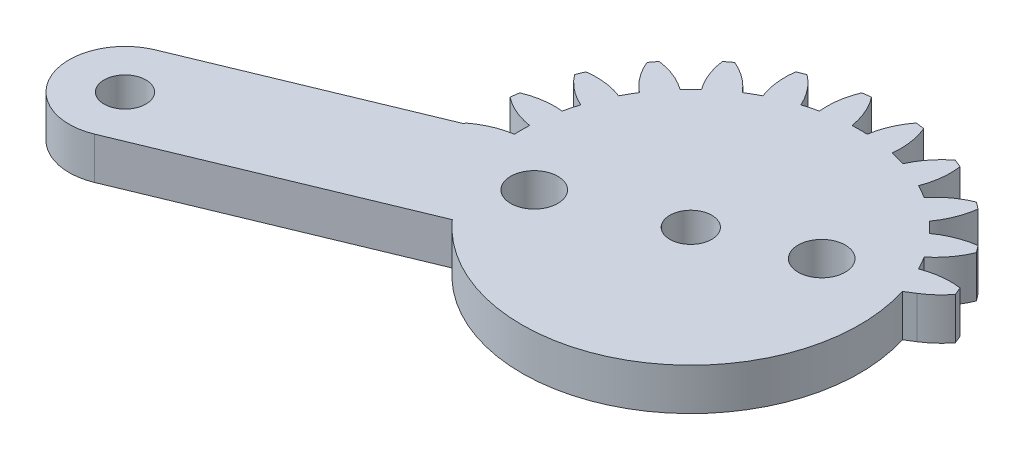
from build123d import *

# Parameters (mm, degrees)
SKETCH1_R              = 1.5
BOSS_EXTRUDE1_DEPTH    = 3
SKETCH3_R              = 1.5
BOSS_EXTRUDE2_DEPTH    = 3
CUT_EXTRUDE1_OUTLINE_R = 1.5
CUT_EXTRUDE1_DEPTH     = 3
SCALE1_SCALE           = 0.888888889
BOSS_EXTRUDE3_START    = -2.666666667
SKETCH5_R              = 1.333333333
BOSS_EXTRUDE3_DEPTH    = 2.666666667
SKETCH6_R              = 1.5
CUT_EXTRUDE2_DEPTH     = 10


# Read off the part's stored shape, not the designer's step: Cut-Extrude1
with BuildPart() as part:
    # Sketch1 → Boss-Extrude1 (new body)
    with BuildSketch(Plane(origin=(0, 0, 0), x_dir=(1, 0, 0), z_dir=(0, 1, 0))):
        with BuildLine():
            Line((20.643657446, 4), (2.081641936, 4))
            ThreePointArc((2.081641936, 4), (2.861028333, 4.588201733), (3.521749436, 5.30713988))
            ThreePointArc((3.521749436, 5.30713988), (3.405395609, 5.596745198), (3.282888305, 5.883801663))
            ThreePointArc((3.282888305, 5.883801663), (1.93527598, 5.894040025), (0.627094961, 5.57027124))
            ThreePointArc((0.627094961, 5.57027124), (0.366286148, 6.046375), (0.084372603, 6.510293938))
            ThreePointArc((0.084372603, 6.510293938), (1.018855105, 7.48132754), (1.683794586, 8.65351323))
            ThreePointArc((1.683794586, 8.65351323), (1.496450048, 8.903135899), (1.303821399, 9.148703928))
            ThreePointArc((1.303821399, 9.148703928), (-0.000522033, 8.809805691), (-1.180330337, 8.158486898))
            ThreePointArc((-1.180330337, 8.158486898), (-1.555477026, 8.550865528), (-1.947855656, 8.926012217))
            ThreePointArc((-1.947855656, 8.926012217), (-1.296536862, 10.105820521), (-0.957638625, 11.410163953))
            ThreePointArc((-0.957638625, 11.410163953), (-1.203206655, 11.602792602), (-1.452829324, 11.79013714))
            ThreePointArc((-1.452829324, 11.79013714), (-2.625015014, 11.125197659), (-3.596048616, 10.190715157))
            ThreePointArc((-3.596048616, 10.190715157), (-4.059967554, 10.472628702), (-4.536071314, 10.733437515))
            ThreePointArc((-4.536071314, 10.733437515), (-4.212302529, 12.041618533), (-4.222540891, 13.389230859))
            ThreePointArc((-4.222540891, 13.389230859), (-4.509597355, 13.511738163), (-4.799202674, 13.62809199))
            ThreePointArc((-4.799202674, 13.62809199), (-5.759348103, 12.682425791), (-6.455432668, 11.528463019))
            ThreePointArc((-6.455432668, 11.528463019), (-6.976508546, 11.680699536), (-7.503891752, 11.809396783))
            ThreePointArc((-7.503891752, 11.809396783), (-7.529737283, 13.156800143), (-7.888414517, 14.455843809))
            ThreePointArc((-7.888414517, 14.455843809), (-8.197396993, 14.499881098), (-8.507248835, 14.537314892))
            ThreePointArc((-8.507248835, 14.537314892), (-9.18992168, 13.375367565), (-9.563620196, 12.080565177))
            ThreePointArc((-9.563620196, 12.080565177), (-10.106342554, 12.09275), (-10.649064912, 12.080565177))
            ThreePointArc((-10.649064912, 12.080565177), (-11.022763428, 13.375367565), (-11.705436272, 14.537314892))
            ThreePointArc((-11.705436272, 14.537314892), (-12.015288115, 14.499881098), (-12.324270591, 14.455843809))
            ThreePointArc((-12.324270591, 14.455843809), (-12.682947825, 13.156800143), (-12.708793355, 11.809396783))
            ThreePointArc((-12.708793355, 11.809396783), (-13.236176561, 11.680699536), (-13.757252439, 11.528463019))
            ThreePointArc((-13.757252439, 11.528463019), (-14.453337005, 12.682425791), (-15.413482434, 13.62809199))
            ThreePointArc((-15.413482434, 13.62809199), (-15.703087752, 13.511738163), (-15.990144217, 13.389230859))
            ThreePointArc((-15.990144217, 13.389230859), (-16.000382579, 12.041618533), (-15.676613793, 10.733437515))
            ThreePointArc((-15.676613793, 10.733437515), (-16.152717554, 10.472628702), (-16.616636492, 10.190715157))
            ThreePointArc((-16.616636492, 10.190715157), (-17.587670094, 11.125197659), (-18.759855783, 11.79013714))
            ThreePointArc((-18.759855783, 11.79013714), (-19.009478453, 11.602792602), (-19.255046482, 11.410163953))
            ThreePointArc((-19.255046482, 11.410163953), (-18.916148245, 10.105820521), (-18.264829452, 8.926012217))
            ThreePointArc((-18.264829452, 8.926012217), (-18.657208082, 8.550865528), (-19.032354771, 8.158486898))
            ThreePointArc((-19.032354771, 8.158486898), (-20.212163074, 8.809805691), (-21.516506507, 9.148703928))
            ThreePointArc((-21.516506507, 9.148703928), (-21.709135156, 8.903135899), (-21.896479694, 8.65351323))
            ThreePointArc((-21.896479694, 8.65351323), (-21.231540213, 7.48132754), (-20.297057711, 6.510293938))
            ThreePointArc((-20.297057711, 6.510293938), (-20.578971255, 6.046375), (-20.839780068, 5.57027124))
            ThreePointArc((-20.839780068, 5.57027124), (-22.147961087, 5.894040025), (-23.495573413, 5.883801663))
            ThreePointArc((-23.495573413, 5.883801663), (-23.618080717, 5.596745198), (-23.734434544, 5.30713988))
            ThreePointArc((-23.734434544, 5.30713988), (-22.788768345, 4.346994451), (-21.634805572, 3.650909885))
            ThreePointArc((-21.634805572, 3.650909885), (-21.78704209, 3.129834008), (-21.915739337, 2.602450802))
            ThreePointArc((-21.915739337, 2.602450802), (-23.263142697, 2.576605271), (-24.562186363, 2.217928037))
            ThreePointArc((-24.562186363, 2.217928037), (-24.606223651, 1.908945561), (-24.643657446, 1.599093719))
            ThreePointArc((-24.643657446, 1.599093719), (-23.481710119, 0.916420874), (-22.186907731, 0.542722358))
            ThreePointArc((-22.186907731, 0.542722358), (-22.199092554, 0), (-22.186907731, -0.542722358))
            ThreePointArc((-22.186907731, -0.542722358), (-23.481710119, -0.916420874), (-24.643657446, -1.599093719))
            ThreePointArc((-24.643657446, -1.599093719), (-24.606223651, -1.908945561), (-24.562186363, -2.217928037))
            ThreePointArc((-24.562186363, -2.217928037), (-23.263142697, -2.576605271), (-21.915739337, -2.602450802))
            ThreePointArc((-21.915739337, -2.602450802), (-21.78704209, -3.129834008), (-21.634805572, -3.650909885))
            ThreePointArc((-21.634805572, -3.650909885), (-22.788768345, -4.346994451), (-23.734434544, -5.30713988))
            ThreePointArc((-23.734434544, -5.30713988), (-23.618080717, -5.596745198), (-23.495573413, -5.883801663))
            ThreePointArc((-23.495573413, -5.883801663), (-22.147961087, -5.894040025), (-20.839780068, -5.57027124))
            ThreePointArc((-20.839780068, -5.57027124), (-20.578971255, -6.046375), (-20.297057711, -6.510293938))
            ThreePointArc((-20.297057711, -6.510293938), (-21.231540213, -7.48132754), (-21.896479694, -8.65351323))
            ThreePointArc((-21.896479694, -8.65351323), (-21.709135156, -8.903135899), (-21.516506507, -9.148703928))
            ThreePointArc((-21.516506507, -9.148703928), (-20.212163074, -8.809805691), (-19.032354771, -8.158486898))
            ThreePointArc((-19.032354771, -8.158486898), (-18.657208082, -8.550865528), (-18.264829452, -8.926012217))
            ThreePointArc((-18.264829452, -8.926012217), (-18.916148245, -10.105820521), (-19.255046482, -11.410163953))
            ThreePointArc((-19.255046482, -11.410163953), (-19.009478453, -11.602792602), (-18.759855783, -11.79013714))
            ThreePointArc((-18.759855783, -11.79013714), (-17.587670094, -11.125197659), (-16.616636492, -10.190715157))
            ThreePointArc((-16.616636492, -10.190715157), (-16.152717554, -10.472628702), (-15.676613793, -10.733437515))
            ThreePointArc((-15.676613793, -10.733437515), (-16.000382579, -12.041618533), (-15.990144217, -13.389230859))
            ThreePointArc((-15.990144217, -13.389230859), (-15.703087752, -13.511738163), (-15.413482434, -13.62809199))
            ThreePointArc((-15.413482434, -13.62809199), (-14.453337005, -12.682425791), (-13.757252439, -11.528463019))
            ThreePointArc((-13.757252439, -11.528463019), (-13.236176561, -11.680699536), (-12.708793355, -11.809396783))
            ThreePointArc((-12.708793355, -11.809396783), (-12.682947825, -13.156800143), (-12.324270591, -14.455843809))
            ThreePointArc((-12.324270591, -14.455843809), (-12.015288115, -14.499881098), (-11.705436272, -14.537314892))
            ThreePointArc((-11.705436272, -14.537314892), (-11.022763428, -13.375367565), (-10.649064912, -12.080565177))
            ThreePointArc((-10.649064912, -12.080565177), (-10.106342554, -12.09275), (-9.563620196, -12.080565177))
            ThreePointArc((-9.563620196, -12.080565177), (-9.18992168, -13.375367565), (-8.507248835, -14.537314892))
            ThreePointArc((-8.507248835, -14.537314892), (-8.197396993, -14.499881098), (-7.888414517, -14.455843809))
            ThreePointArc((-7.888414517, -14.455843809), (-7.529737283, -13.156800143), (-7.503891752, -11.809396783))
            ThreePointArc((-7.503891752, -11.809396783), (-6.976508546, -11.680699536), (-6.455432668, -11.528463019))
            ThreePointArc((-6.455432668, -11.528463019), (-5.759348103, -12.682425791), (-4.799202674, -13.62809199))
            ThreePointArc((-4.799202674, -13.62809199), (-4.509597355, -13.511738163), (-4.222540891, -13.389230859))
            ThreePointArc((-4.222540891, -13.389230859), (-4.212302529, -12.041618533), (-4.536071314, -10.733437515))
            ThreePointArc((-4.536071314, -10.733437515), (-4.059967554, -10.472628702), (-3.596048616, -10.190715157))
            ThreePointArc((-3.596048616, -10.190715157), (-2.625015014, -11.125197659), (-1.452829324, -11.79013714))
            ThreePointArc((-1.452829324, -11.79013714), (-1.203206655, -11.602792602), (-0.957638625, -11.410163953))
            ThreePointArc((-0.957638625, -11.410163953), (-1.296536862, -10.105820521), (-1.947855656, -8.926012217))
            ThreePointArc((-1.947855656, -8.926012217), (-1.555477026, -8.550865528), (-1.180330337, -8.158486898))
            ThreePointArc((-1.180330337, -8.158486898), (-0.000522033, -8.809805691), (1.303821399, -9.148703928))
            ThreePointArc((1.303821399, -9.148703928), (1.496450048, -8.903135899), (1.683794586, -8.65351323))
            ThreePointArc((1.683794586, -8.65351323), (1.018855105, -7.48132754), (0.084372603, -6.510293938))
            ThreePointArc((0.084372603, -6.510293938), (0.366286148, -6.046375), (0.627094961, -5.57027124))
            ThreePointArc((0.627094961, -5.57027124), (1.93527598, -5.894040025), (3.282888305, -5.883801663))
            ThreePointArc((3.282888305, -5.883801663), (3.405395609, -5.596745198), (3.521749436, -5.30713988))
            ThreePointArc((3.521749436, -5.30713988), (2.861028333, -4.588201733), (2.081641936, -4))
            Line((2.081641936, -4), (20.643657446, -4))
            ThreePointArc((20.643657446, -4), (24.643657446, 0), (20.643657446, 4))
        make_face()
        with Locations(Location((-10.106342554, 0, 0), (0, 0, 270))):
            Circle(SKETCH1_R, mode=Mode.SUBTRACT)
        with Locations(Location((20.643657446, 0, 0), (0, 0, 270))):
            Circle(SKETCH1_R, mode=Mode.SUBTRACT)
    extrude(amount=BOSS_EXTRUDE1_DEPTH)

    # Sketch3 → Boss-Extrude2 (add)
    with BuildSketch(Plane(origin=(0, 3, 0), x_dir=(1, 0, 0), z_dir=(0, 1, 0))):
        with BuildLine():
            Line((-14.106342554, 0), (-20.558846273, 0))
            Line((-20.558846273, 0), (-40.277341791, -8.167668273))
            ThreePointArc((-40.277341791, -8.167668273), (-42.442126192, -13.393920133), (-37.215874332, -15.558704533))
            Line((-37.215874332, -15.558704533), (-8.575608824, -3.69551813))
            ThreePointArc((-8.575608824, -3.69551813), (-12.328623486, -3.325878449), (-14.106342554, 0))
        make_face()
        with Locations(Location((-38.746608062, -11.863186403, 0), (0, 0, 270))):
            Circle(SKETCH3_R, mode=Mode.SUBTRACT)
    extrude(amount=-BOSS_EXTRUDE2_DEPTH)

    # Cut-Extrude1 outline → Cut-Extrude1 (cut)
    # profile 1 of 11: a face of its own
    with BuildSketch(Plane(origin=(0, 0, 0), x_dir=(1, 0, 0), z_dir=(0, 1, 0))):
        with BuildLine():
            Line((2.081641936, 4), (1.43808022, 3.600125745))
            ThreePointArc((1.43808022, 3.600125745), (1.939395695, -1.065266441), (0.627094961, -5.57027124))
            ThreePointArc((0.627094961, -5.57027124), (1.93527598, -5.894040025), (3.282888305, -5.883801663))
            ThreePointArc((3.282888305, -5.883801663), (3.405395609, -5.596745198), (3.521749436, -5.30713988))
            ThreePointArc((3.521749436, -5.30713988), (2.861028333, -4.588201733), (2.081641936, -4))
            Line((2.081641936, -4), (20.643657446, -4))
            ThreePointArc((20.643657446, -4), (24.643657446, 0), (20.643657446, 4))
            Line((20.643657446, 4), (2.081641936, 4))
        make_face()
        with Locations((20.643657446, 0)):
            Circle(CUT_EXTRUDE1_OUTLINE_R, mode=Mode.SUBTRACT)
    # profile 2 of 11: a face of its own
    with BuildSketch(Plane(origin=(0, 0, 0), x_dir=(1, 0, 0), z_dir=(0, 1, 0))):
        with BuildLine():
            ThreePointArc((-21.516506507, -9.148703928), (-20.212163075, -8.809805691), (-19.032354771, -8.158486898))
            ThreePointArc((-19.032354771, -8.158486898), (-19.075783612, -8.110716964), (-19.118956803, -8.062715855))
            Line((-19.118956803, -8.062715855), (-21.572155055, -9.078863843))
            ThreePointArc((-21.572155055, -9.078863843), (-21.544384086, -9.113826359), (-21.516506507, -9.148703928))
        make_face()
    # profile 3 of 11: a face of its own
    with BuildSketch(Plane(origin=(0, 0, 0), x_dir=(1, 0, 0), z_dir=(0, 1, 0))):
        with BuildLine():
            ThreePointArc((-18.759855783, -11.79013714), (-17.587670094, -11.125197659), (-16.616636492, -10.190715157))
            ThreePointArc((-16.616636492, -10.190715157), (-17.467942325, -9.593823606), (-18.264829452, -8.926012217))
            ThreePointArc((-18.264829452, -8.926012217), (-18.916148245, -10.105820521), (-19.255046482, -11.410163953))
            ThreePointArc((-19.255046482, -11.410163953), (-19.009478453, -11.602792602), (-18.759855783, -11.79013714))
        make_face()
    # profile 4 of 11: a face of its own
    with BuildSketch(Plane(origin=(0, 0, 0), x_dir=(1, 0, 0), z_dir=(0, 1, 0))):
        with BuildLine():
            ThreePointArc((-15.413482434, -13.62809199), (-14.453337005, -12.682425791), (-13.757252439, -11.528463019))
            ThreePointArc((-13.757252439, -11.528463019), (-14.73403763, -11.172244217), (-15.676613793, -10.733437515))
            ThreePointArc((-15.676613793, -10.733437515), (-16.000382579, -12.041618533), (-15.990144217, -13.389230859))
            ThreePointArc((-15.990144217, -13.389230859), (-15.703087752, -13.511738163), (-15.413482434, -13.62809199))
        make_face()
    # profile 5 of 11: a face of its own
    with BuildSketch(Plane(origin=(0, 0, 0), x_dir=(1, 0, 0), z_dir=(0, 1, 0))):
        with BuildLine():
            ThreePointArc((-11.705436272, -14.537314892), (-11.022763428, -13.375367565), (-10.649064912, -12.080565177))
            ThreePointArc((-10.649064912, -12.080565177), (-11.684763165, -11.989294847), (-12.708793355, -11.809396783))
            ThreePointArc((-12.708793355, -11.809396783), (-12.682947825, -13.156800143), (-12.324270591, -14.455843809))
            ThreePointArc((-12.324270591, -14.455843809), (-12.015288115, -14.499881098), (-11.705436272, -14.537314892))
        make_face()
    # profile 6 of 11: a face of its own
    with BuildSketch(Plane(origin=(0, 0, 0), x_dir=(1, 0, 0), z_dir=(0, 1, 0))):
        with BuildLine():
            ThreePointArc((-7.888414517, -14.455843809), (-7.529737283, -13.156800143), (-7.503891752, -11.809396783))
            ThreePointArc((-7.503891752, -11.809396783), (-8.527921943, -11.989294847), (-9.563620196, -12.080565177))
            ThreePointArc((-9.563620196, -12.080565177), (-9.18992168, -13.375367565), (-8.507248835, -14.537314892))
            ThreePointArc((-8.507248835, -14.537314892), (-8.197396993, -14.499881098), (-7.888414517, -14.455843809))
        make_face()
    # profile 7 of 11: a face of its own
    with BuildSketch(Plane(origin=(0, 0, 0), x_dir=(1, 0, 0), z_dir=(0, 1, 0))):
        with BuildLine():
            ThreePointArc((-4.222540891, -13.389230859), (-4.212302529, -12.041618534), (-4.536071314, -10.733437515))
            ThreePointArc((-4.536071314, -10.733437515), (-5.478647477, -11.172244217), (-6.455432668, -11.528463019))
            ThreePointArc((-6.455432668, -11.528463019), (-5.759348103, -12.682425792), (-4.799202674, -13.62809199))
            ThreePointArc((-4.799202674, -13.62809199), (-4.509597356, -13.511738163), (-4.222540891, -13.389230859))
        make_face()
    # profile 8 of 11: a face of its own
    with BuildSketch(Plane(origin=(0, 0, 0), x_dir=(1, 0, 0), z_dir=(0, 1, 0))):
        with BuildLine():
            ThreePointArc((-0.957638625, -11.410163953), (-1.296536862, -10.105820521), (-1.947855656, -8.926012217))
            ThreePointArc((-1.947855656, -8.926012217), (-2.744742783, -9.593823606), (-3.596048616, -10.190715157))
            ThreePointArc((-3.596048616, -10.190715157), (-2.625015014, -11.125197659), (-1.452829324, -11.79013714))
            ThreePointArc((-1.452829324, -11.79013714), (-1.203206654, -11.602792602), (-0.957638625, -11.410163953))
        make_face()
    # profile 9 of 11: a face of its own
    with BuildSketch(Plane(origin=(0, 0, 0), x_dir=(1, 0, 0), z_dir=(0, 1, 0))):
        with BuildLine():
            ThreePointArc((1.683794586, -8.65351323), (1.018855105, -7.48132754), (0.084372603, -6.510293938))
            ThreePointArc((0.084372603, -6.510293938), (-0.512518948, -7.361599771), (-1.180330337, -8.158486898))
            ThreePointArc((-1.180330337, -8.158486898), (-0.000522033, -8.809805691), (1.303821399, -9.148703928))
            ThreePointArc((1.303821399, -9.148703928), (1.496450048, -8.903135899), (1.683794586, -8.65351323))
        make_face()
    # profile 10 of 11: a face of its own
    with BuildSketch(Plane(origin=(0, 0, 0), x_dir=(1, 0, 0), z_dir=(0, 1, 0))):
        with Locations((-16.573499281, -2.678784027)):
            Circle(CUT_EXTRUDE1_OUTLINE_R)
    # profile 11 of 11: a face of its own
    with BuildSketch(Plane(origin=(0, 0, 0), x_dir=(1, 0, 0), z_dir=(0, 1, 0))):
        with Locations((-3.639185826, 2.678784027)):
            Circle(CUT_EXTRUDE1_OUTLINE_R)
    extrude(amount=CUT_EXTRUDE1_DEPTH, mode=Mode.SUBTRACT)


with BuildPart() as part_1:
    # Scale1: scaled about (-15.682514655, 1.5, 1.664027293)
    add(part.part.scale(SCALE1_SCALE).moved(Location((-1.742501628, 0.166666667, 0.184891921))))

    # Sketch5 → Boss-Extrude3 (add)
    with BuildSketch(Plane(origin=(0, 2.833333333, 0), x_dir=(1, 0, 0), z_dir=(0, 1, 0)).offset(BOSS_EXTRUDE3_START)):
        with Locations((-16.47450099, -2.566033278)):
            Circle(SKETCH5_R)
        with Locations((-4.977333474, 2.196249436)):
            Circle(SKETCH5_R)
    extrude(amount=BOSS_EXTRUDE3_DEPTH)

    # Sketch6 → Cut-Extrude2 (cut)
    with BuildSketch(Plane(origin=(0, 2.833333333, 0), x_dir=(1, 0, 0), z_dir=(0, 1, 0))):
        with Locations(Location((-17.770445964, -3.102831263, 0), (0, 0, 270))):
            Circle(SKETCH6_R)
        with Locations(Location((-4.836132509, 2.25473679, 0), (0, 0, 270))):
            Circle(SKETCH6_R)
    extrude(amount=-CUT_EXTRUDE2_DEPTH, mode=Mode.SUBTRACT)


solid = part_1.part
